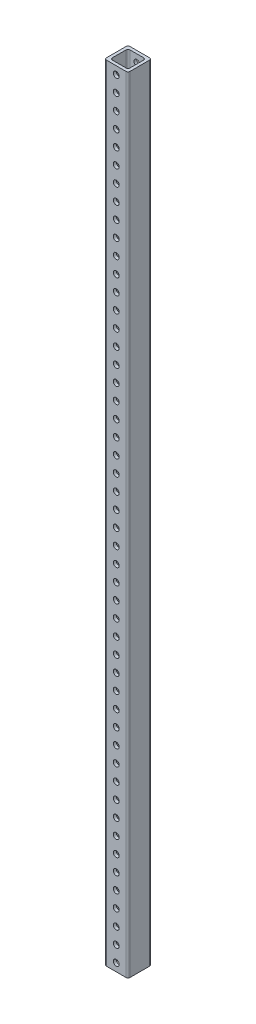
from build123d import *

# Parameters (mm, degrees)
SKETCH1_W           = 38.1
SKETCH1_H           = 38.1
SKETCH1_W_2         = 28.575
SKETCH1_H_2         = 28.575
BOSS_EXTRUDE1_DEPTH = 1270
FILLET1_R           = 3.175
SKETCH2_R           = 4.7625
CUT_EXTRUDE1_DEPTH  = 50.8


with BuildPart() as part:
    # Sketch1 → Boss-Extrude1 (new body)
    with BuildSketch(Plane(origin=(0, 0, 0), x_dir=(1, 0, 0), z_dir=(0, 1, 0))):
        with Locations((19.05, -19.05)):
            Rectangle(SKETCH1_W, SKETCH1_H)
        with Locations((19.05, -19.05)):
            Rectangle(SKETCH1_W_2, SKETCH1_H_2, mode=Mode.SUBTRACT)
    extrude(amount=BOSS_EXTRUDE1_DEPTH)

    # Fillet1
    fillet1_edges = [part.edges().sort_by_distance(p)[0] for p in [
        (33.3375, 635, 4.7625),
        (33.3375, 635, 33.3375),
        (4.7625, 635, 4.7625),
        (4.7625, 635, 33.3375),
        (0, 635, 0),
        (38.1, 635, 0),
        (0, 635, 38.1),
        (38.1, 635, 38.1),
    ]]
    fillet(fillet1_edges, radius=FILLET1_R)

    # Sketch2 → Cut-Extrude1 (cut)
    with BuildSketch(Plane.XY.offset(38.1)):
        with Locations((19.05, 1257.3)):
            Circle(SKETCH2_R)
        with Locations((19.05, 1231.9)):
            Circle(SKETCH2_R)
        with Locations((19.05, 1206.5)):
            Circle(SKETCH2_R)
        with Locations((19.05, 1181.1)):
            Circle(SKETCH2_R)
        with Locations((19.05, 1155.7)):
            Circle(SKETCH2_R)
        with Locations((19.05, 1130.3)):
            Circle(SKETCH2_R)
        with Locations((19.05, 1104.9)):
            Circle(SKETCH2_R)
        with Locations((19.05, 1079.5)):
            Circle(SKETCH2_R)
        with Locations((19.05, 1054.1)):
            Circle(SKETCH2_R)
        with Locations((19.05, 1028.7)):
            Circle(SKETCH2_R)
        with Locations((19.05, 1003.3)):
            Circle(SKETCH2_R)
        with Locations((19.05, 977.9)):
            Circle(SKETCH2_R)
        with Locations((19.05, 952.5)):
            Circle(SKETCH2_R)
        with Locations((19.05, 927.1)):
            Circle(SKETCH2_R)
        with Locations((19.05, 901.7)):
            Circle(SKETCH2_R)
        with Locations((19.05, 876.3)):
            Circle(SKETCH2_R)
        with Locations((19.05, 850.9)):
            Circle(SKETCH2_R)
        with Locations((19.05, 825.5)):
            Circle(SKETCH2_R)
        with Locations((19.05, 800.1)):
            Circle(SKETCH2_R)
        with Locations((19.05, 774.7)):
            Circle(SKETCH2_R)
        with Locations((19.05, 749.3)):
            Circle(SKETCH2_R)
        with Locations((19.05, 723.9)):
            Circle(SKETCH2_R)
        with Locations((19.05, 698.5)):
            Circle(SKETCH2_R)
        with Locations((19.05, 673.1)):
            Circle(SKETCH2_R)
        with Locations((19.05, 647.7)):
            Circle(SKETCH2_R)
        with Locations((19.05, 622.3)):
            Circle(SKETCH2_R)
        with Locations((19.05, 596.9)):
            Circle(SKETCH2_R)
        with Locations((19.05, 571.5)):
            Circle(SKETCH2_R)
        with Locations((19.05, 546.1)):
            Circle(SKETCH2_R)
        with Locations((19.05, 520.7)):
            Circle(SKETCH2_R)
        with Locations((19.05, 495.3)):
            Circle(SKETCH2_R)
        with Locations((19.05, 469.9)):
            Circle(SKETCH2_R)
        with Locations((19.05, 444.5)):
            Circle(SKETCH2_R)
        with Locations((19.05, 419.1)):
            Circle(SKETCH2_R)
        with Locations((19.05, 393.7)):
            Circle(SKETCH2_R)
        with Locations((19.05, 368.3)):
            Circle(SKETCH2_R)
        with Locations((19.05, 342.9)):
            Circle(SKETCH2_R)
        with Locations((19.05, 317.5)):
            Circle(SKETCH2_R)
        with Locations((19.05, 292.1)):
            Circle(SKETCH2_R)
        with Locations((19.05, 266.7)):
            Circle(SKETCH2_R)
        with Locations((19.05, 241.3)):
            Circle(SKETCH2_R)
        with Locations((19.05, 215.9)):
            Circle(SKETCH2_R)
        with Locations((19.05, 190.5)):
            Circle(SKETCH2_R)
        with Locations((19.05, 165.1)):
            Circle(SKETCH2_R)
        with Locations((19.05, 139.7)):
            Circle(SKETCH2_R)
        with Locations((19.05, 114.3)):
            Circle(SKETCH2_R)
        with Locations((19.05, 88.9)):
            Circle(SKETCH2_R)
        with Locations((19.05, 63.5)):
            Circle(SKETCH2_R)
        with Locations((19.05, 38.1)):
            Circle(SKETCH2_R)
        with Locations((19.05, 12.7)):
            Circle(SKETCH2_R)
    extrude(amount=-CUT_EXTRUDE1_DEPTH, mode=Mode.SUBTRACT)


solid = part.part
